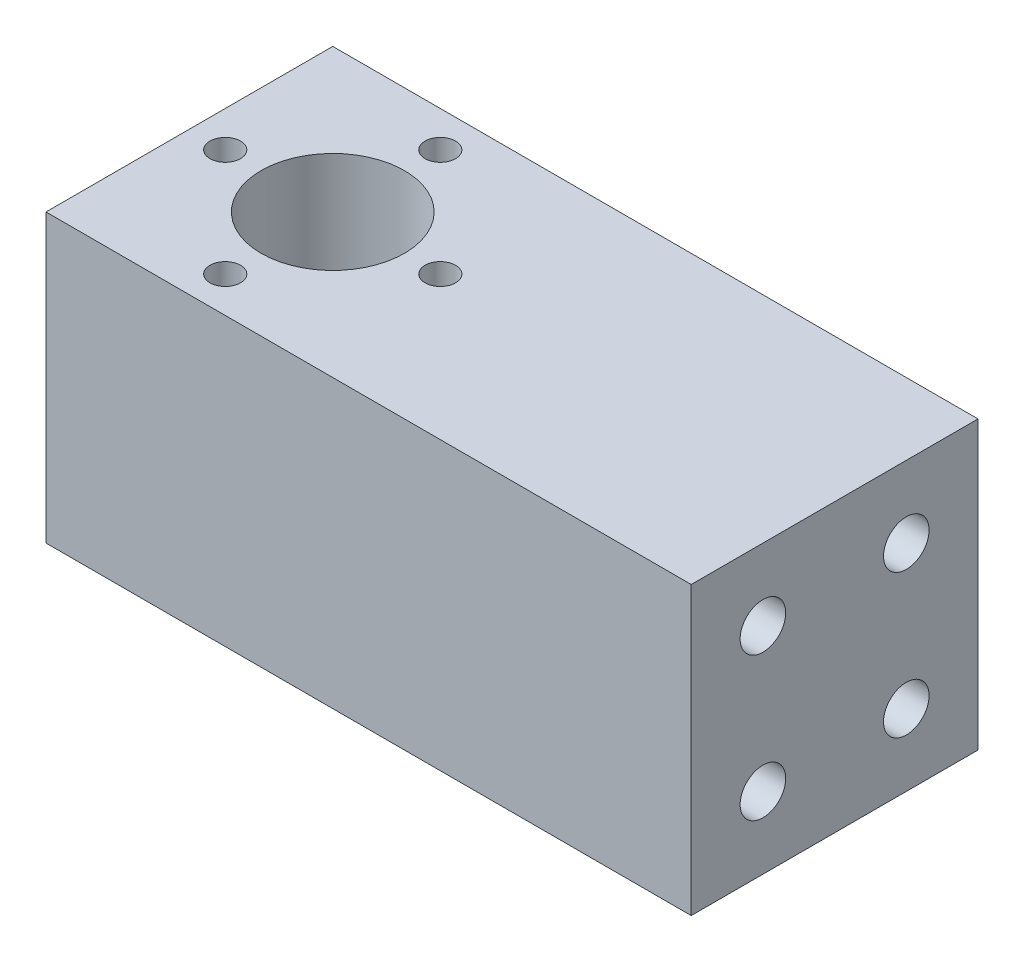
from build123d import *

# Parameters (mm, degrees)
SKETCH1_W                  = 88.9
SKETCH1_H                  = 76.2
BOSS_EXTRUDE1_DEPTH        = 12.7
SKETCH9_R                  = 6.35
CUT_EXTRUDE2_DEPTH         = 60.905780189
FILLET1_R                  = 38.1
F_10_32_TAPPED_HOLE1_D     = 4.0386
F_10_32_TAPPED_HOLE1_DEPTH = 9.652
F_10_32_TAPPED_HOLE1_TIP   = 1.213317848
CUT_EXTRUDE3_DEPTH         = 60.905780189
F_6_32_TAPPED_HOLE1_D      = 2.7051
CIRPATTERN1_COUNT          = 4


with BuildPart() as part:
    # Sketch1 → Boss-Extrude1 (new body)
    with BuildSketch(Plane(origin=(0, 0, 0), x_dir=(1, 0, 0), z_dir=(0, 1, 0))):
        Rectangle(SKETCH1_W, SKETCH1_H)
    extrude(amount=BOSS_EXTRUDE1_DEPTH)

    # Sketch9 → Cut-Extrude2 (cut, through all)
    with BuildSketch(Plane(origin=(0, 12.7, 0), x_dir=(1, 0, 0), z_dir=(0, 1, 0))):
        with Locations(Location((0, 0, 0), (0, 0, 270))):
            Circle(SKETCH9_R)
    extrude(amount=-CUT_EXTRUDE2_DEPTH, mode=Mode.SUBTRACT)

    # Fillet1
    fillet1_edges = [part.edges().sort_by_distance(p)[0] for p in [
        (-44.45, 6.35, -38.1),
        (-44.45, 6.35, 38.1),
    ]]
    fillet(fillet1_edges, radius=FILLET1_R - 0.0001)  # a hair under: the kernel refuses the full size

    # #10-32 Tapped Hole1
    with Locations(Plane(origin=(44.45, 0, 0), x_dir=(0, 0, -1), z_dir=(1, 0, 0))):
        with Locations((-6.35, 6.35), (6.35, 6.35)):
            Hole(F_10_32_TAPPED_HOLE1_D / 2, depth=F_10_32_TAPPED_HOLE1_DEPTH)
            with Locations((0, 0, -(F_10_32_TAPPED_HOLE1_DEPTH + F_10_32_TAPPED_HOLE1_TIP / 2))):  # 118° drill point
                Cone(0, F_10_32_TAPPED_HOLE1_D / 2, F_10_32_TAPPED_HOLE1_TIP, mode=Mode.SUBTRACT)

    # Sketch13 → Cut-Extrude3 (cut, through all)
    with BuildSketch(Plane(origin=(0, 12.7, 0), x_dir=(1, 0, 0), z_dir=(0, 1, 0))):
        with BuildLine():
            Line((-12.7, 12.7), (44.45, 12.7))
            Line((44.45, 12.7), (44.45, 38.1))
            Line((44.45, 38.1), (-6.35, 38.1))
            ThreePointArc((-6.35, 38.1), (-33.290768363, 26.940768363), (-44.45, 0))
            ThreePointArc((-44.45, 0), (-33.290768363, -26.940768363), (-6.35, -38.1))
            Line((-6.35, -38.1), (44.45, -38.1))
            Line((44.45, -38.1), (44.45, -12.7))
            Line((44.45, -12.7), (-12.7, -12.7))
            Line((-12.7, -12.7), (-12.7, 12.7))
        make_face()
    extrude(amount=-CUT_EXTRUDE3_DEPTH, mode=Mode.SUBTRACT)


with BuildPart() as cut_extrude3_kept_piece:
    # of the separate pieces the step leaves, the one the design keeps (cut_extrude3_pieces_kept)
    add(part.part.solids().sort_by_distance((44.45, 12.7, 12.7))[0])

    # Mirror2: Cut-Extrude3 kept piece across plane


with BuildPart() as cut_extrude3_kept_piece_1:
    add(cut_extrude3_kept_piece.part)
    add(cut_extrude3_kept_piece.part.mirror(Plane(origin=(0, 0, 0), x_dir=(0, 0, 1), z_dir=(0, -1, 0))))

    # #6-32 Tapped Hole1 (through all)
    with Locations(Plane(origin=(0, 12.7, 0), x_dir=(1, 0, 0), z_dir=(0, 1, 0))):
        with Locations((-9.525, 0)):
            f_6_32_tapped_hole1 = Hole(F_6_32_TAPPED_HOLE1_D / 2)

    # CirPattern1: #6-32 Tapped Hole1 ×4 about axis
    cirpattern1_axis = Axis((0, 0, 0), (0, 1, 0))
    for i in range(1, CIRPATTERN1_COUNT):
        add(f_6_32_tapped_hole1.rotate(cirpattern1_axis, i * 360 / CIRPATTERN1_COUNT), mode=Mode.SUBTRACT)


solid = cut_extrude3_kept_piece_1.part
